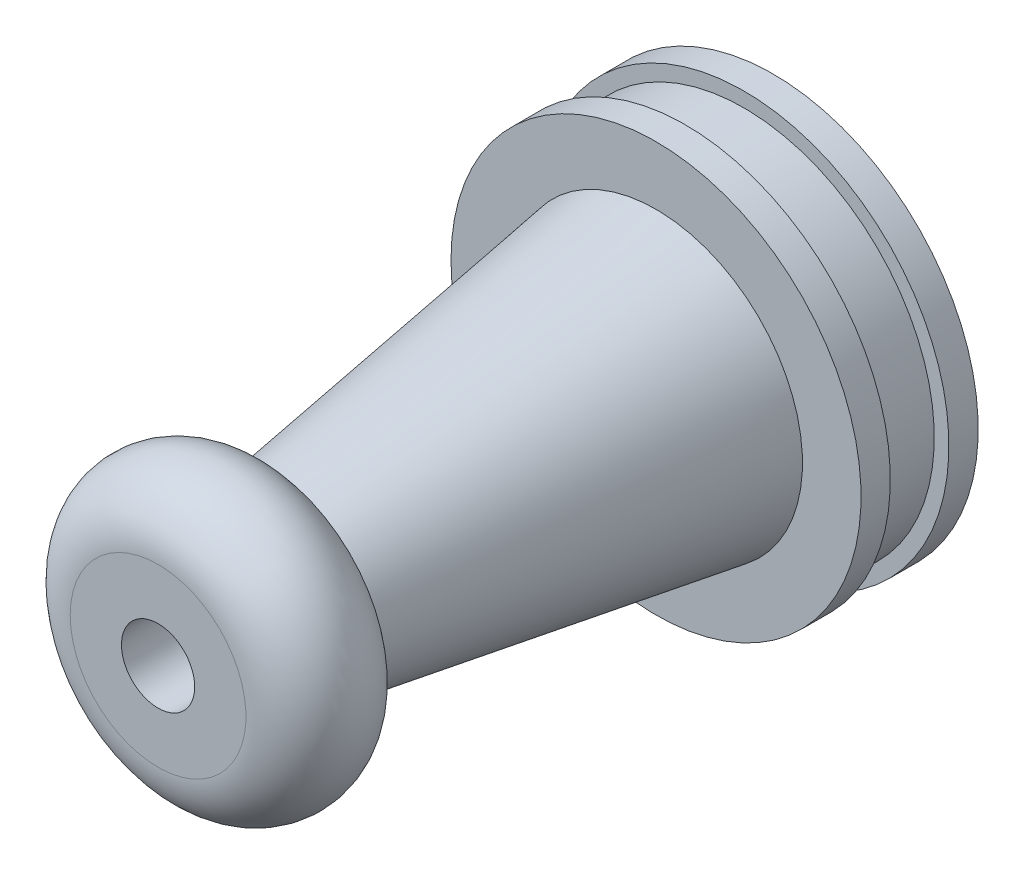
from build123d import *

# Parameters (mm, degrees)
SKETCH5_R           = 15.24
SKETCH6_R           = 25.4
SKETCH7_R           = 35.56
BOSS_EXTRUDE1_DEPTH = 20.32
CUT_EXTRUDE4_START  = -10.16
SKETCH8_R           = 35.56
SKETCH8_R_2         = 33.02
CUT_EXTRUDE4_DEPTH  = 10.16
SKETCH9_R           = 30.48
CUT_EXTRUDE5_DEPTH  = 17.78
SKETCH4_R           = 6.35
CUT_EXTRUDE6_DEPTH  = 118.939177545
FILLET1_R           = 2.54
BOSS_EXTRUDE2_START = 17.78
SKETCH12_R          = 30.48
BOSS_EXTRUDE2_DEPTH = 17.78
SKETCH14_R          = 6.35
CUT_EXTRUDE7_DEPTH  = 118.939177696


with BuildPart() as part:
    # Sketch3 → Revolve1 (revolve)
    with BuildSketch(Plane(origin=(0, 0, 0), x_dir=(1, 0, 0), z_dir=(0, 1, 0)), mode=Mode.PRIVATE) as revolve1_sk:
        with BuildLine():
            Line((0, 10.16), (0, -10.16))
            Line((0, -10.16), (15.24, -10.16))
            ThreePointArc((15.24, -10.16), (25.4, 0), (15.24, 10.16))
            Line((15.24, 10.16), (0, 10.16))
        make_face()
    revolve(revolve1_sk.sketch.rotate(Axis((0, 0, -50.309770133), (0, 0, 1)), 180), axis=Axis((0, 0, -50.309770133), (0, 0, 1)))

    # Sketch5 → Loft1 section 0
    with BuildSketch(Plane(origin=(0, 0, -10.16), x_dir=(-1, 0, 0), z_dir=(0, 0, -1))):
        Circle(SKETCH5_R)
    # Sketch6 → Loft1 section 1
    with BuildSketch(Plane.XY.offset(-76.2)):
        Circle(SKETCH6_R)
    loft()

    # Sketch7 → Boss-Extrude1 (add)
    with BuildSketch(Plane(origin=(0, 0, -76.2), x_dir=(-1, 0, 0), z_dir=(0, 0, -1))):
        Circle(SKETCH7_R)
    extrude(amount=BOSS_EXTRUDE1_DEPTH)

    # Sketch8 → Cut-Extrude4 (cut)
    with BuildSketch(Plane(origin=(0, 0, -91.44), x_dir=(-1, 0, 0), z_dir=(0, 0, -1)).offset(CUT_EXTRUDE4_START)):
        Circle(SKETCH8_R)
        Circle(SKETCH8_R_2, mode=Mode.SUBTRACT)
    extrude(amount=CUT_EXTRUDE4_DEPTH, mode=Mode.SUBTRACT)

    # Sketch9 → Cut-Extrude5 (cut)
    with BuildSketch(Plane(origin=(0, 0, -96.52), x_dir=(-1, 0, 0), z_dir=(0, 0, -1))):
        Circle(SKETCH9_R)
    extrude(amount=-CUT_EXTRUDE5_DEPTH, mode=Mode.SUBTRACT)

    # Sketch4 → Cut-Extrude6 (cut, through all)
    with BuildSketch(Plane.XY.offset(10.16)):
        Circle(SKETCH4_R)
    extrude(amount=-CUT_EXTRUDE6_DEPTH, mode=Mode.SUBTRACT)

    # Fillet1
    fillet1_edges = [part.edges().sort_by_distance(p)[0] for p in [
        (30.48, 0, -78.74),
    ]]
    fillet(fillet1_edges, radius=FILLET1_R)

    # Sketch12 → Boss-Extrude2 (add)
    with BuildSketch(Plane(origin=(0, 0, -78.74), x_dir=(-1, 0, 0), z_dir=(0, 0, -1)).offset(BOSS_EXTRUDE2_START)):
        Circle(SKETCH12_R)
    extrude(amount=-BOSS_EXTRUDE2_DEPTH)

    # Cut-Loft2: read off the stored shape, not the designer's step
    # Cut-Loft2: loft between two sections, ruled curve by curve
    cut_loft2_from = [
        Edge.make_bspline([(19.631934156, 16.116673394, -96.52), (-12.601412631, 55.380541707, -96.52), (-51.865280944, 23.147194919, -96.52), (-19.631934156, -16.116673394, -96.52), (12.601412631, -55.380541707, -96.52), (51.865280944, -23.147194919, -96.52), (19.631934156, 16.116673394, -96.52)], [0, 0, 0, 0, 0.5, 0.5, 0.5, 1, 1, 1, 1], 3, [1, 0.333333333, 0.333333333, 1, 0.333333333, 0.333333333, 1]),
    ]
    cut_loft2_to = [
        Edge.make_bspline([(-6.35, 0, -78.74), (-6.35, -12.7, -78.74), (6.35, -12.7, -78.74), (6.35, 0, -78.74), (6.35, 12.7, -78.74), (-6.35, 12.7, -78.74), (-6.35, 0, -78.74)], [0, 0, 0, 0, 0.5, 0.5, 0.5, 1, 1, 1, 1], 3, [1, 0.333333333, 0.333333333, 1, 0.333333333, 0.333333333, 1]),
    ]
    cut_loft2 = Solid(Shell([*[Face.make_surface_from_curves(cut_loft2_from[k], cut_loft2_to[k]) for k in range(1)], Face(Wire(cut_loft2_from)), Face(Wire(cut_loft2_to))]))
    add(cut_loft2, mode=Mode.SUBTRACT)

    # Sketch14 → Cut-Extrude7 (cut, through all)
    with BuildSketch(Plane.XY.offset(10.16)):
        Circle(SKETCH14_R)
    extrude(amount=-CUT_EXTRUDE7_DEPTH, mode=Mode.SUBTRACT)


solid = part.part
